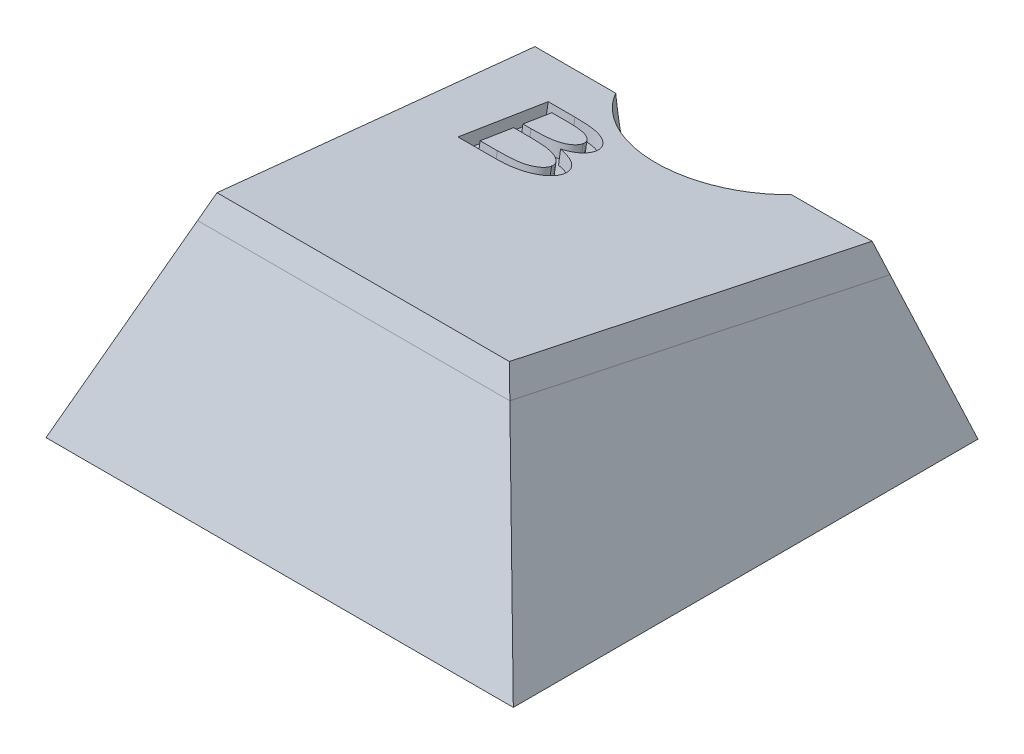
from build123d import *

# Parameters (mm, degrees)
OTHER_START         = 7.189240539
OTHER_2_OUTLINE_W   = 16
OTHER_2_OUTLINE_H   = 16
OTHER_2_DEPTH       = 1.9877561
SKETCH_20_R         = 2.75
EXTRUDE_2_DEPTH     = 6.5
CUT_EXTRUDE_1_DEPTH = 0.5
SKETCH_22_R         = 4
CUT_EXTRUDE_2_DEPTH = 7.5


# Read off the part's stored shape, not the designer's step: 相交2
with BuildPart() as part:
    # 草图4 → Loft 1 section 0
    with BuildSketch(Plane(origin=(0, 8.2, 0), x_dir=(1, 0, 0), z_dir=(0, 1, 0))):
        with BuildLine():
            Line((-5.6, 6.8), (5.6, 6.8))
            Line((5.6, 6.8), (5.6, -5.7))
            Line((5.6, -5.7), (-5.6, -5.7))
            Line((-5.6, -5.7), (-5.6, 6.8))
        make_face()
    # 草图1 → Loft 1 section 1
    with BuildSketch(Plane(origin=(0, 0, 0), x_dir=(1, 0, 0), z_dir=(0, 1, 0))):
        with BuildLine():
            Line((-8.95, -8.9), (8.95, -8.9))
            Line((8.95, -8.9), (8.95, 8.9))
            Line((8.95, 8.9), (-8.95, 8.9))
            Line((-8.95, 8.9), (-8.95, -8.9))
        make_face()
    loft()

    # 相交2 outline → 相交2 (cut)
    with BuildSketch(Plane(origin=(0, 0, 0), x_dir=(1, 0, 0), z_dir=(0, 0.9872752829851917, -0.15902048800865198)).offset(OTHER_START)):
        Rectangle(OTHER_2_OUTLINE_W, OTHER_2_OUTLINE_H)
    extrude(amount=OTHER_2_DEPTH, mode=Mode.SUBTRACT)

    # 草图19 → Loft 1 2 section 0
    with BuildSketch(Plane(origin=(0, 6.132664073, -0.987788564), x_dir=(1, 0, 0), z_dir=(0, 0.9872752829851916, -0.15902048800865207))):
        with BuildLine():
            Line((-4.985089723, 5.299749211), (4.985089723, 5.299749211))
            Line((4.985089723, 5.299749211), (4.287230721, -5.442213697))
            Line((4.287230721, -5.442213697), (-4.287230721, -5.442213697))
            Line((-4.287230721, -5.442213697), (-4.985089723, 5.299749211))
        make_face()
    # 草图8 → Loft 1 2 section 1
    with BuildSketch(Plane.XZ):
        with BuildLine():
            Line((-7.15, 7.2), (7.15, 7.2))
            Line((7.15, 7.2), (7.15, -7.5))
            Line((7.15, -7.5), (-7.15, -7.5))
            Line((-7.15, -7.5), (-7.15, 7.2))
        make_face()
    loft(mode=Mode.SUBTRACT)

    # 草图20 → 凸台-拉伸2 (add)
    with BuildSketch(Plane.XZ):
        with Locations(Location((0, 0, 0), (0, 0, 270))):
            Circle(SKETCH_20_R)
        Polygon((-2.2, 0.8), (-0.8, 0.8), (-0.8, 2.2), (0.8, 2.2), (0.8, 0.8), (2.2, 0.8), (2.2, -0.8), (0.8, -0.8), (0.8, -2.2), (-0.8, -2.2), (-0.8, -0.8), (-2.2, -0.8), align=None, mode=Mode.SUBTRACT)
    extrude(amount=-EXTRUDE_2_DEPTH)

    # 草图21 → 切除-拉伸1 (cut)
    with BuildSketch(Plane(origin=(0, 7.097759487, -1.143236539), x_dir=(1, 0, 0), z_dir=(0, 0.9872752829851916, -0.15902048800865207))):
        with BuildLine():
            Line((-4.075955723, 4.374408411), (-3.05161678, 4.374408411))
            add(Edge.make_bspline(
                [(-3.05161678, 4.374408411), (-3.001598177, 4.37422557), (-2.904339475, 4.373870045), (-2.763152441, 4.368665036), (-2.630787829, 4.361353255), (-2.507581664, 4.350074843), (-2.393003416, 4.336098995), (-2.287386768, 4.319759613), (-2.190702321, 4.299464771), (-2.102553843, 4.275462633), (-2.02069076, 4.248417722), (-1.944052325, 4.218671859), (-1.871820937, 4.185226888), (-1.803585437, 4.149371864), (-1.740597017, 4.107930824), (-1.680956816, 4.065216099), (-1.626276856, 4.018102997), (-1.576276747, 3.968254753), (-1.53138788, 3.915631236), (-1.491980376, 3.861504021), (-1.458087704, 3.806449275), (-1.43097458, 3.749274429), (-1.410270719, 3.690673858), (-1.394505384, 3.630718089), (-1.385098589, 3.56935381), (-1.384133592, 3.527952708), (-1.38364803, 3.50712075)],
                knots=[0, 0, 0, 0, 1.727133696, 3.358326119, 4.878149777, 6.304391432, 7.629726349, 8.863648063, 9.993787461, 11.039234741, 12.016682314, 12.969840003, 13.87620352, 14.764420512, 15.628515143, 16.477592799, 17.296048855, 18.117800747, 18.913499522, 19.681881416, 20.427899323, 21.142662237, 21.862509911, 22.571095379, 23.281012387, 24, 24, 24, 24], degree=3))
            add(Edge.make_bspline(
                [(-1.38364803, 3.50712075), (-1.385412282, 3.468348204), (-1.388910839, 3.391461246), (-1.42095224, 3.279461488), (-1.471320058, 3.173101493), (-1.529107281, 3.090495822), (-1.584691676, 3.028842776), (-1.631123728, 2.983643069), (-1.682562114, 2.940920335), (-1.738589565, 2.900102161), (-1.799873027, 2.862563579), (-1.865299808, 2.826587473), (-1.935344564, 2.793012224), (-1.98417587, 2.77281639), (-2.009048671, 2.762529404)],
                knots=[0, 0, 0, 0, 1.344649222, 2.666474061, 4.014062304, 5.41970358, 6.150026244, 6.896555969, 7.669043806, 8.471425933, 9.302905494, 10.164184025, 11.06490551, 12, 12, 12, 12], degree=3))
            add(Edge.make_bspline(
                [(-2.009048671, 2.762529404), (-1.977920981, 2.754996611), (-1.917306862, 2.740328204), (-1.829559386, 2.715932573), (-1.747632696, 2.689342975), (-1.670272781, 2.664549503), (-1.599588756, 2.635500242), (-1.533515625, 2.608342187), (-1.473506413, 2.578504898), (-1.401750644, 2.538013126), (-1.320454432, 2.484098783), (-1.232731939, 2.412990017), (-1.157794968, 2.334214687), (-1.093935011, 2.249817411), (-1.043468641, 2.160184049), (-1.006060497, 2.066312746), (-0.983696742, 1.968275226), (-0.981102992, 1.901429924), (-0.979801877, 1.867897994)],
                knots=[0, 0, 0, 0, 1.040401352, 2.025945749, 2.957610977, 3.838748948, 4.663524247, 5.439134026, 6.158967321, 6.838896101, 8.114975742, 9.323328772, 10.499359089, 11.638211642, 12.753227844, 13.830378753, 14.911642469, 16, 16, 16, 16], degree=3))
            add(Edge.make_bspline(
                [(-0.979801877, 1.867897994), (-0.981029473, 1.833646659), (-0.983459912, 1.765834667), (-1.006577059, 1.666832464), (-1.041459332, 1.571612689), (-1.09229665, 1.480899499), (-1.157707146, 1.394733239), (-1.235753214, 1.311173804), (-1.329676927, 1.233761622), (-1.435446571, 1.159592435), (-1.553929285, 1.092855208), (-1.682429672, 1.03354565), (-1.821434347, 0.984996199), (-1.969653473, 0.944188002), (-2.12762314, 0.912897118), (-2.295317391, 0.890925288), (-2.472464022, 0.876289135), (-2.593987323, 0.875045113), (-2.656184088, 0.874408411)],
                knots=[0, 0, 0, 0, 0.763794375, 1.512186817, 2.258665885, 3.022620734, 3.824296693, 4.669829699, 5.569978408, 6.537158664, 7.551586153, 8.60252133, 9.69369207, 10.835799672, 12.033384994, 13.286741793, 14.611328995, 16, 16, 16, 16], degree=3))
            Line((-2.656184088, 0.874408411), (-4.075955723, 0.874408411))
            Line((-4.075955723, 0.874408411), (-4.075955723, 4.374408411))
        make_face()
        with BuildLine():
            Line((-3.582365979, 4.015434052), (-3.582365979, 2.89363918))
            Line((-3.582365979, 2.89363918), (-3.274573511, 2.89363918))
            add(Edge.make_bspline(
                [(-3.274573511, 2.89363918), (-3.229234608, 2.894037102), (-3.14182053, 2.894804303), (-3.015329988, 2.897035757), (-2.898263152, 2.903171565), (-2.790415727, 2.909495423), (-2.6919831, 2.919395843), (-2.602964895, 2.931479837), (-2.522737381, 2.944078774), (-2.43017236, 2.965548195), (-2.325916803, 2.996637022), (-2.213810068, 3.045984254), (-2.114923061, 3.104045743), (-2.031417989, 3.172044051), (-1.963132903, 3.246655866), (-1.913980137, 3.327274535), (-1.882872139, 3.412615332), (-1.879120194, 3.471344935), (-1.877237774, 3.500810654)],
                knots=[0, 0, 0, 0, 1.300077838, 2.506569319, 3.626932325, 4.661071425, 5.603901159, 6.462528421, 7.236988455, 7.931124199, 9.1859622, 10.350118682, 11.434989577, 12.463773904, 13.427075439, 14.32002997, 15.157128221, 16, 16, 16, 16], degree=3))
            add(Edge.make_bspline(
                [(-1.877237774, 3.500810654), (-1.878090356, 3.52026362), (-1.879770849, 3.558606611), (-1.891776361, 3.614572779), (-1.912652517, 3.667069895), (-1.94078659, 3.716733169), (-1.977847183, 3.762720595), (-2.023432155, 3.804723671), (-2.076216593, 3.844102145), (-2.137282697, 3.880116871), (-2.20703143, 3.912207698), (-2.286219485, 3.940566317), (-2.375213143, 3.962587503), (-2.473301087, 3.982952277), (-2.581178984, 3.996632495), (-2.698498063, 4.008322574), (-2.825561166, 4.014251811), (-2.913491199, 4.015030452), (-2.959068703, 4.015434052)],
                knots=[0, 0, 0, 0, 0.704770075, 1.389145107, 2.062265897, 2.745067049, 3.450040637, 4.193008615, 4.985718742, 5.832502292, 6.757032351, 7.764250842, 8.87554471, 10.07639704, 11.392709723, 12.81352688, 14.348328909, 16, 16, 16, 16], degree=3))
            Line((-2.959068703, 4.015434052), (-3.582365979, 4.015434052))
        make_face(mode=Mode.SUBTRACT)
        with BuildLine():
            Line((-3.582365979, 2.534664821), (-3.582365979, 1.23338277))
            Line((-3.582365979, 1.23338277), (-2.925414857, 1.23338277))
            add(Edge.make_bspline(
                [(-2.925414857, 1.23338277), (-2.87843879, 1.233762727), (-2.787984434, 1.23449435), (-2.657071337, 1.236961408), (-2.535944574, 1.242321818), (-2.424505301, 1.251162574), (-2.322676057, 1.260268307), (-2.230585111, 1.273130598), (-2.148143507, 1.287369469), (-2.052767711, 1.309568231), (-1.945828922, 1.343476113), (-1.829800232, 1.395799803), (-1.726263469, 1.457063537), (-1.638169932, 1.52937046), (-1.565540416, 1.607250263), (-1.512850304, 1.69077302), (-1.479720256, 1.778095564), (-1.47548575, 1.838182595), (-1.47339162, 1.867897994)],
                knots=[0, 0, 0, 0, 1.29843179, 2.500184008, 3.618878599, 4.648866362, 5.589855277, 6.444005784, 7.218207981, 7.901363496, 9.149526468, 10.311741131, 11.4128985, 12.464137763, 13.451792752, 14.342600541, 15.180350819, 16, 16, 16, 16], degree=3))
            add(Edge.make_bspline(
                [(-1.47339162, 1.867897994), (-1.474057939, 1.886411489), (-1.475384595, 1.923272276), (-1.486301385, 1.977500806), (-1.503895793, 2.030194167), (-1.529359322, 2.080409977), (-1.561622114, 2.129090654), (-1.600943659, 2.175575902), (-1.646816465, 2.221086121), (-1.700338495, 2.263107634), (-1.758970648, 2.304010862), (-1.82377859, 2.341171111), (-1.893956852, 2.374278996), (-1.96876264, 2.405798633), (-2.049273018, 2.432646906), (-2.135127862, 2.4566183), (-2.226255262, 2.476740829), (-2.288984721, 2.487698036), (-2.32104787, 2.493298635)],
                knots=[0, 0, 0, 0, 0.77785496, 1.548726791, 2.316271961, 3.107298279, 3.908573286, 4.766644542, 5.663022547, 6.620650135, 7.623734104, 8.66706768, 9.757067915, 10.884860646, 12.078135655, 13.322666349, 14.631524187, 16, 16, 16, 16], degree=3))
            add(Edge.make_bspline(
                [(-2.32104787, 2.493298635), (-2.346033301, 2.496750191), (-2.400093694, 2.504218241), (-2.488058336, 2.512220196), (-2.588577808, 2.519174973), (-2.701968389, 2.52441673), (-2.827916954, 2.529782033), (-2.96677814, 2.531897127), (-3.1182147, 2.534390125), (-3.223390168, 2.534570849), (-3.27807912, 2.534664821)],
                knots=[0, 0, 0, 0, 0.631419024, 1.366186615, 2.21079442, 3.154006331, 4.208025658, 5.366807578, 6.630797325, 8, 8, 8, 8], degree=3))
            Line((-3.27807912, 2.534664821), (-3.582365979, 2.534664821))
        make_face(mode=Mode.SUBTRACT)
    extrude(amount=-CUT_EXTRUDE_1_DEPTH, mode=Mode.SUBTRACT)

    # 草图22 → 切除-拉伸2 (cut)
    with BuildSketch(Plane.XZ):
        with Locations((0, -9.5)):
            Circle(SKETCH_22_R)
    extrude(amount=-CUT_EXTRUDE_2_DEPTH, mode=Mode.SUBTRACT)


solid = part.part
